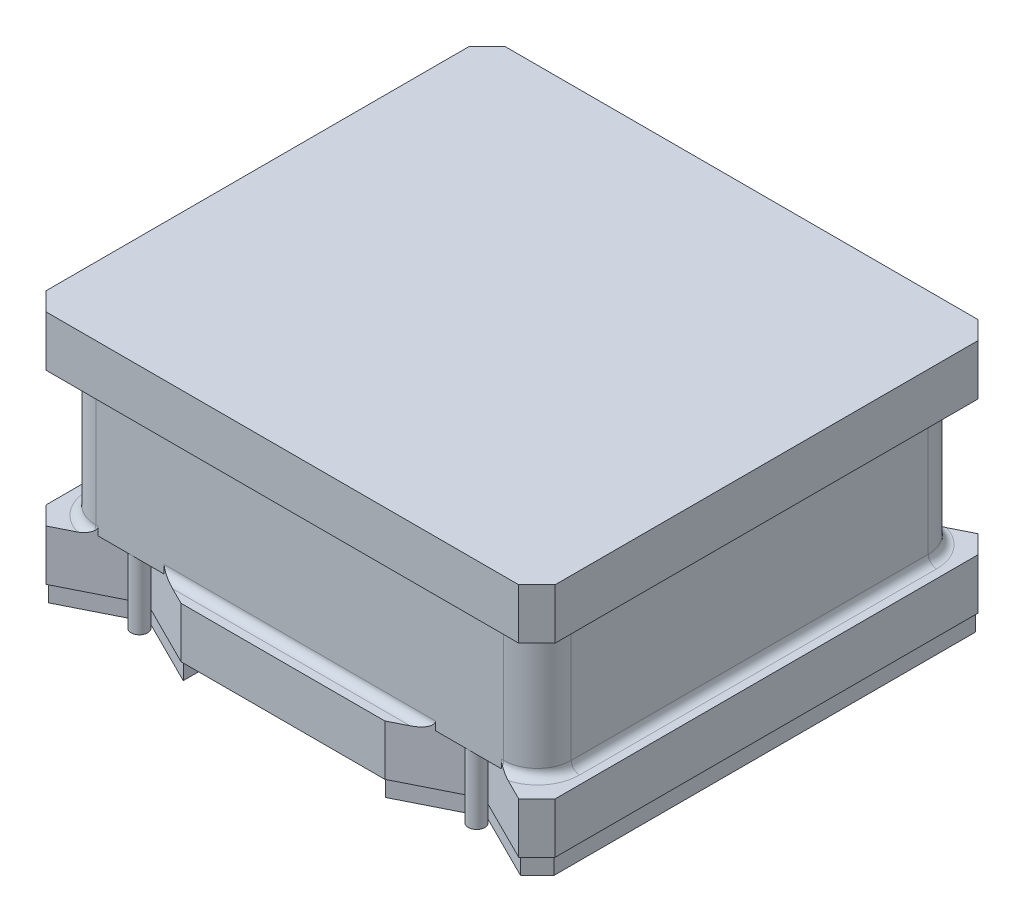
from build123d import *

# Parameters (mm, degrees)
RESSALTO_EXTRUS_O1_DEPTH   = 0.1
RESSALTO_EXTRUS_O1_2_DEPTH = 0.1
RESSALTO_EXTRUS_O2_DEPTH   = 0.3
ESBO_O3_W                  = 2.82
ESBO_O3_H                  = 2.517888544
RESSALTO_EXTRUS_O3_DEPTH   = 0.8
RESSALTO_EXTRUS_O4_DEPTH   = 0.3
FILETE1_R                  = 0.2
FILETE2_R                  = 0.05
FILETE3_R                  = 0.05
RESSALTO_EXTRUS_O5_REACH   = 4.312
ESBO_O5_R                  = 0.048881966


with BuildPart() as part:
    # Esboço1 → Ressalto-extrusão1 (new body)
    with BuildSketch(Plane(origin=(0, 0, 0), x_dir=(1, 0, 0), z_dir=(0, 1, 0))):
        Polygon((-1.5, 1.25), (-1.5, -1.25), (-1.4, -1.35), (-1, -1.15), (-0.6, -1.35), (-0.6, 1.35), (-1, 1.15), (-1.4, 1.35), align=None)
    extrude(amount=RESSALTO_EXTRUS_O1_DEPTH)



with BuildPart() as body_2:
    # Esboço1 → Ressalto-extrus_o1 2 (new body)
    with BuildSketch(Plane(origin=(0, 0, 0), x_dir=(1, 0, 0), z_dir=(0, 1, 0))):
        Polygon((1.4, -1.35), (1.5, -1.25), (1.5, 1.25), (1.4, 1.35), (1, 1.15), (0.6, 1.35), (0.6, -1.35), (1, -1.15), align=None)
    extrude(amount=RESSALTO_EXTRUS_O1_2_DEPTH)


with BuildPart() as part_1:
    add(part.part)

    add(body_2.part)  # Ressalto-extrusão2 merges body 2
    # Esboço2 → Ressalto-extrusão2 (add)
    with BuildSketch(Plane(origin=(0, 0.1, 0), x_dir=(1, 0, 0), z_dir=(0, 1, 0))):
        Polygon((-0.604472136, 1.358944272), (-1, 1.16118034), (-1.40197453, 1.362167605), (-1.51, 1.254142136), (-1.51, -1.254142136), (-1.40197453, -1.362167605), (-1, -1.16118034), (-0.604472136, -1.358944272), (0.604472136, -1.358944272), (1, -1.16118034), (1.40197453, -1.362167605), (1.51, -1.254142136), (1.51, 1.254142136), (1.40197453, 1.362167605), (1, 1.16118034), (0.604472136, 1.358944272), align=None)
    extrude(amount=RESSALTO_EXTRUS_O2_DEPTH)

    # Esboço3 → Ressalto-extrusão3 (add)
    with BuildSketch(Plane(origin=(0, 0.4, 0), x_dir=(1, 0, 0), z_dir=(0, 1, 0))):
        Rectangle(ESBO_O3_W, ESBO_O3_H)
    extrude(amount=RESSALTO_EXTRUS_O3_DEPTH)

    # Esboço4 → Ressalto-extrusão4 (add)
    with BuildSketch(Plane(origin=(0, 1.2, 0), x_dir=(1, 0, 0), z_dir=(0, 1, 0))):
        Polygon((-1.51, 1.254142136), (-1.40197453, 1.362167605), (1.40197453, 1.362167605), (1.51, 1.254142136), (1.51, -1.254142136), (1.40197453, -1.362167605), (-1.40197453, -1.362167605), (-1.51, -1.254142136), align=None)
    extrude(amount=RESSALTO_EXTRUS_O4_DEPTH)

    # Filete1
    filete1_edges = [part_1.edges().sort_by_distance(p)[0] for p in [
        (1.41, 0.8, 1.258944272),
        (1.41, 0.8, -1.258944272),
        (-1.41, 0.8, -1.258944272),
        (-1.41, 0.8, 1.258944272),
    ]]
    fillet(filete1_edges, radius=FILETE1_R)

    # Filete2
    filete2_edges = [part_1.edges().sort_by_distance(p)[0] for p in [
        (-1.41, 1.2, 0),
        (0, 1.2, -1.258944272),
        (1.41, 1.2, 0),
        (0, 1.2, 1.258944272),
        (-1.351421356, 1.2, -1.200365628),
        (1.351421356, 1.2, -1.200365628),
        (1.351421356, 1.2, 1.200365628),
        (-1.351421356, 1.2, 1.200365628),
    ]]
    fillet(filete2_edges, radius=FILETE2_R)

    # Filete3
    # the kernel refuses this fillet: 0.05 mm, written as the material it adds along each edge
    with BuildSketch(Plane(origin=(-1.41, 0.4, 1.058944272), x_dir=(0, 1, 0), z_dir=(0, 0, -1)), Plane(origin=(1.41, 0.4, -1.058944272), x_dir=(0, 1, 0), z_dir=(0, 0, 1))) as filete3_piece_1:
        with BuildLine():
            CenterArc((FILETE3_R, -FILETE3_R), FILETE3_R, 90, 90)
            Line((0, -FILETE3_R), (0, 0))
            Line((0, 0), (FILETE3_R, 0))
        make_face()
    extrude(amount=2.117888544)
    with BuildSketch(Plane(origin=(1.070527864, 0.4, -1.258944272), x_dir=(0, 1, 0), z_dir=(1, 0, 0))) as filete3_piece_2_section:
        with BuildLine():
            CenterArc((FILETE3_R, -FILETE3_R), FILETE3_R, 90, 90)
            Line((0, -FILETE3_R), (0, 0))
            Line((0, 0), (FILETE3_R, 0))
        make_face()
    filete3_piece_2 = extrude(amount=0.139472136, mode=Mode.PRIVATE)
    filete3_piece_2 = split(filete3_piece_2, bisect_by=Plane(origin=(1.203892593, 0.418399611, -1.263126636), z_dir=(0.4472135954999593, 0, 0.8944271909999152)), keep=Keep.TOP, mode=Mode.PRIVATE)
    add(filete3_piece_2)
    with BuildSketch(Plane(origin=(-1.070527864, 0.4, 1.258944272), x_dir=(0, 1, 0), z_dir=(-1, 0, 0))) as filete3_piece_3_section:
        with BuildLine():
            CenterArc((FILETE3_R, -FILETE3_R), FILETE3_R, 90, 90)
            Line((0, -FILETE3_R), (0, 0))
            Line((0, 0), (FILETE3_R, 0))
        make_face()
    filete3_piece_3 = extrude(amount=0.139472136, mode=Mode.PRIVATE)
    filete3_piece_3 = split(filete3_piece_3, bisect_by=Plane(origin=(-1.203892593, 0.418399611, 1.263126636), z_dir=(-0.44721359549995854, 0, -0.8944271909999156)), keep=Keep.TOP, mode=Mode.PRIVATE)
    add(filete3_piece_3)
    with BuildSketch(Plane(origin=(-1.21, 0.4, -1.058944272), x_dir=(0, 0, -1), z_dir=(1, 0, 0))) as filete3_piece_4_section:
        with BuildLine():
            CenterArc((0.2 + FILETE3_R, FILETE3_R), FILETE3_R, 180, 90)
            Line((0.2 + FILETE3_R, 0), (0.2, 0))
            Line((0.2, 0), (0.2, FILETE3_R))
        make_face()
    filete3_piece_4 = revolve(axis=Axis((-1.21, 0.4, -1.058944272), (0, 1, 0)), revolution_arc=90, mode=Mode.PRIVATE)
    filete3_piece_4 = split(filete3_piece_4, bisect_by=Plane(origin=(-1.30894977, 0.414305441, -1.315655225), z_dir=(-0.44721359549995854, 0, 0.8944271909999156)), keep=Keep.TOP, mode=Mode.PRIVATE)
    add(filete3_piece_4)
    with BuildSketch(Plane(origin=(1.21, 0.4, -1.058944272), x_dir=(0, 0, -1), z_dir=(-1, 0, 0))) as filete3_piece_5_section:
        with BuildLine():
            CenterArc((0.2 + FILETE3_R, -FILETE3_R), FILETE3_R, 90, 90)
            Line((0.2 + FILETE3_R, 0), (0.2, 0))
            Line((0.2, 0), (0.2, -FILETE3_R))
        make_face()
    filete3_piece_5 = revolve(axis=Axis((1.21, 0.4, -1.058944272), (0, -1, 0)), revolution_arc=90, mode=Mode.PRIVATE)
    filete3_piece_5 = split(filete3_piece_5, bisect_by=Plane(origin=(1.30894977, 0.414305441, -1.315655225), z_dir=(0.4472135954999593, 0, 0.8944271909999152)), keep=Keep.TOP, mode=Mode.PRIVATE)
    add(filete3_piece_5)
    with BuildSketch(Plane(origin=(1.21, 0.4, 1.058944272), x_dir=(1, 0, 0), z_dir=(0, 0, -1))) as filete3_piece_6_section:
        with BuildLine():
            CenterArc((0.2 + FILETE3_R, -FILETE3_R), FILETE3_R, 90, 90)
            Line((0.2 + FILETE3_R, 0), (0.2, 0))
            Line((0.2, 0), (0.2, -FILETE3_R))
        make_face()
    filete3_piece_6 = revolve(axis=Axis((1.21, 0.4, 1.058944272), (0, -1, 0)), revolution_arc=90, mode=Mode.PRIVATE)
    filete3_piece_6 = split(filete3_piece_6, bisect_by=Plane(origin=(1.30894977, 0.414305441, 1.315655225), z_dir=(0.4472135954999591, 0, -0.8944271909999153)), keep=Keep.TOP, mode=Mode.PRIVATE)
    add(filete3_piece_6)
    with BuildSketch(Plane(origin=(-1.21, 0.4, 1.058944272), x_dir=(0, 0, 1), z_dir=(1, 0, 0))) as filete3_piece_7_section:
        with BuildLine():
            CenterArc((0.2 + FILETE3_R, -FILETE3_R), FILETE3_R, 90, 90)
            Line((0.2 + FILETE3_R, 0), (0.2, 0))
            Line((0.2, 0), (0.2, -FILETE3_R))
        make_face()
    filete3_piece_7 = revolve(axis=Axis((-1.21, 0.4, 1.058944272), (0, -1, 0)), revolution_arc=90, mode=Mode.PRIVATE)
    filete3_piece_7 = split(filete3_piece_7, bisect_by=Plane(origin=(-1.30894977, 0.414305441, 1.315655225), z_dir=(-0.44721359549995854, 0, -0.8944271909999156)), keep=Keep.TOP, mode=Mode.PRIVATE)
    add(filete3_piece_7)
    with BuildSketch(Plane(origin=(-1.21, 0.4, -1.258944272), x_dir=(0, 1, 0), z_dir=(1, 0, 0))) as filete3_piece_8_section:
        with BuildLine():
            CenterArc((FILETE3_R, -FILETE3_R), FILETE3_R, 90, 90)
            Line((0, -FILETE3_R), (0, 0))
            Line((0, 0), (FILETE3_R, 0))
        make_face()
    filete3_piece_8 = extrude(amount=0.139472136, mode=Mode.PRIVATE)
    filete3_piece_8 = split(filete3_piece_8, bisect_by=Plane(origin=(-1.203892593, 0.418399611, -1.263126636), z_dir=(-0.44721359549995854, 0, 0.8944271909999156)), keep=Keep.TOP, mode=Mode.PRIVATE)
    add(filete3_piece_8)
    with BuildSketch(Plane(origin=(-0.929472136, 0.4, -1.258944272), x_dir=(0, 1, 0), z_dir=(1, 0, 0))) as filete3_piece_9_section:
        with BuildLine():
            CenterArc((FILETE3_R, -FILETE3_R), FILETE3_R, 90, 90)
            Line((0, -FILETE3_R), (0, 0))
            Line((0, 0), (FILETE3_R, 0))
        make_face()
    filete3_piece_9 = extrude(amount=1.858944272, mode=Mode.PRIVATE)
    filete3_piece_9 = split(filete3_piece_9, bisect_by=Plane(origin=(-0.156516973, 0.41130062, -1.582921854), z_dir=(0.44721359549995937, 0, 0.8944271909999152)), keep=Keep.TOP, mode=Mode.PRIVATE)
    filete3_piece_9 = split(filete3_piece_9, bisect_by=Plane(origin=(0.156516973, 0.41130062, -1.582921854), z_dir=(-0.44721359549995915, 0, 0.8944271909999153)), keep=Keep.TOP, mode=Mode.PRIVATE)
    add(filete3_piece_9)
    with BuildSketch(Plane(origin=(1.21, 0.4, 1.258944272), x_dir=(0, 1, 0), z_dir=(-1, 0, 0))) as filete3_piece_10_section:
        with BuildLine():
            CenterArc((FILETE3_R, -FILETE3_R), FILETE3_R, 90, 90)
            Line((0, -FILETE3_R), (0, 0))
            Line((0, 0), (FILETE3_R, 0))
        make_face()
    filete3_piece_10 = extrude(amount=0.139472136, mode=Mode.PRIVATE)
    filete3_piece_10 = split(filete3_piece_10, bisect_by=Plane(origin=(1.203892593, 0.418399611, 1.263126636), z_dir=(0.4472135954999591, 0, -0.8944271909999153)), keep=Keep.TOP, mode=Mode.PRIVATE)
    add(filete3_piece_10)
    with BuildSketch(Plane(origin=(0.929472136, 0.4, 1.258944272), x_dir=(0, 1, 0), z_dir=(-1, 0, 0))) as filete3_piece_11_section:
        with BuildLine():
            CenterArc((FILETE3_R, -FILETE3_R), FILETE3_R, 90, 90)
            Line((0, -FILETE3_R), (0, 0))
            Line((0, 0), (FILETE3_R, 0))
        make_face()
    filete3_piece_11 = extrude(amount=1.858944272, mode=Mode.PRIVATE)
    filete3_piece_11 = split(filete3_piece_11, bisect_by=Plane(origin=(0.156516973, 0.41130062, 1.582921854), z_dir=(-0.44721359549995876, 0, -0.8944271909999155)), keep=Keep.TOP, mode=Mode.PRIVATE)
    filete3_piece_11 = split(filete3_piece_11, bisect_by=Plane(origin=(-0.156516973, 0.41130062, 1.582921854), z_dir=(0.44721359549995926, 0, -0.8944271909999153)), keep=Keep.TOP, mode=Mode.PRIVATE)
    add(filete3_piece_11)

    # Ressalto-extrusão5: up to this face of the body (flat: up to its plane)
    ressalto_extrus_o5_end = Plane(part_1.part.faces().sort_by_distance((-1.051696165, 0, 0))[0])
    # Esboço5 → Ressalto-extrusão5 (add, up to the picked face)
    with BuildSketch(Plane.XZ.offset(-0.4), mode=Mode.PRIVATE) as ressalto_extrus_o5_sk1:
        with Locations(Location((-1, 1.210062306, 0), (0, 0, 90))):
            Circle(ESBO_O5_R)
    ressalto_extrus_o5_tool1 = split(extrude(ressalto_extrus_o5_sk1.sketch, amount=RESSALTO_EXTRUS_O5_REACH, mode=Mode.PRIVATE), bisect_by=ressalto_extrus_o5_end, keep=Keep.BOTH, mode=Mode.PRIVATE)
    # Esboço5 → Ressalto-extrusão5 (add, up to the picked face)
    with BuildSketch(Plane.XZ.offset(-0.4), mode=Mode.PRIVATE) as ressalto_extrus_o5_sk2:
        with Locations(Location((1, 1.210062306, 0), (0, 0, 90))):
            Circle(ESBO_O5_R)
    ressalto_extrus_o5_tool2 = split(extrude(ressalto_extrus_o5_sk2.sketch, amount=RESSALTO_EXTRUS_O5_REACH, mode=Mode.PRIVATE), bisect_by=ressalto_extrus_o5_end, keep=Keep.BOTH, mode=Mode.PRIVATE)
    add(ressalto_extrus_o5_tool1.solids().sort_by(Axis((-1, 0.4, 1.210062), (0, -1, 0)))[0])
    add(ressalto_extrus_o5_tool2.solids().sort_by(Axis((1, 0.4, 1.210062), (0, -1, 0)))[0])


solid = part_1.part
